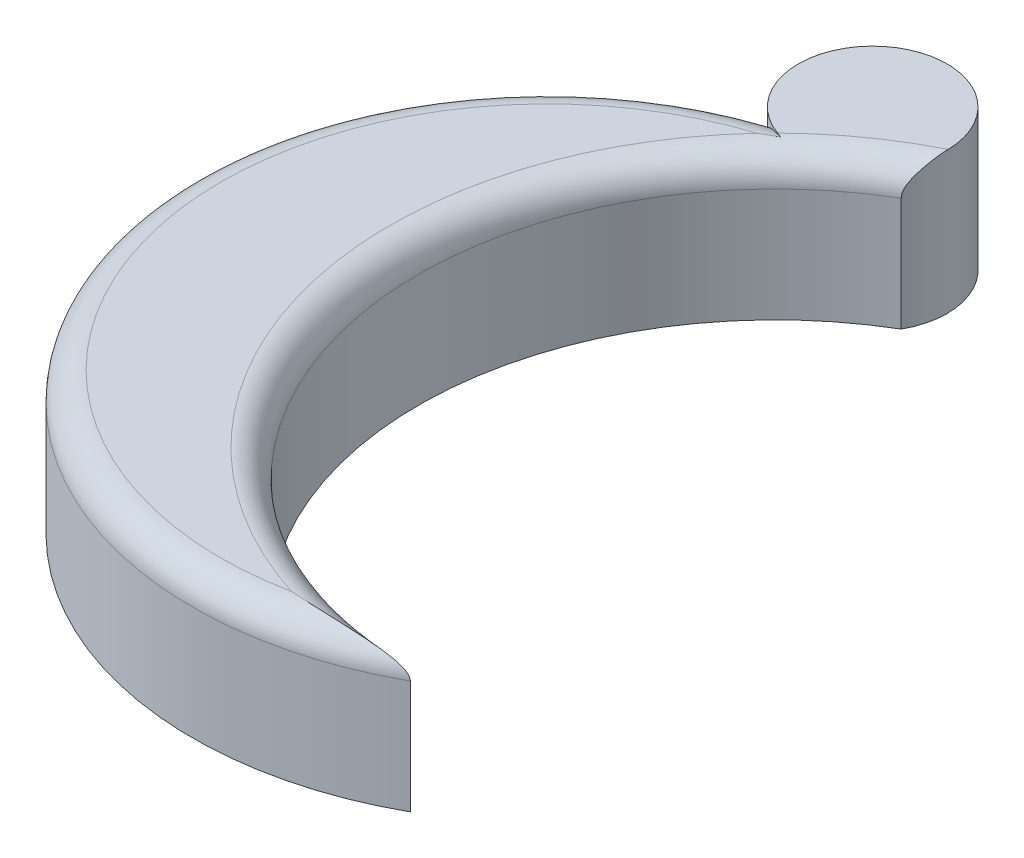
from build123d import *

# Parameters (mm, degrees)
SALIENTE_EXTRUIR1_DEPTH = 4
REDONDEO6_R             = 0.8


with BuildPart() as part:
    # Croquis1 → Saliente-Extruir1 (new body)
    with BuildSketch(Plane(origin=(0, 0, 0), x_dir=(1, 0, 0), z_dir=(0, 1, 0))):
        with BuildLine():
            ThreePointArc((-61.883639125, 14.575898233), (-67.780374095, 1.042618708), (-53.773153629, -3.61773673))
            ThreePointArc((-53.773153629, -3.61773673), (-63.274753441, 3.910149301), (-58.646815221, 15.11424029))
            ThreePointArc((-58.646815221, 15.11424029), (-60.82603012, 18.216941024), (-61.883639125, 14.575898233))
        make_face()
    extrude(amount=SALIENTE_EXTRUIR1_DEPTH)

    # Redondeo6
    # the kernel refuses this fillet: 0.8 mm, written as the material it takes off along each edge
    with BuildSketch(Plane(origin=(-53.533974817, 4, -6.444492505), x_dir=(0.17426350002173693, 0, 0.9846990568494387), z_dir=(0.9846990568494387, 0, -0.17426350002173693))) as redondeo6_piece_1:
        with BuildLine():
            CenterArc((10.065071469 + REDONDEO6_R, REDONDEO6_R), REDONDEO6_R, 180, 90)
            Line((10.065071469 + REDONDEO6_R, 0), (10.065071469, 0))
            Line((10.065071469, 0), (10.065071469, REDONDEO6_R))
        make_face()
    revolve(axis=Axis((-53.533974817, 4, -6.444492505), (0, -1, 0)), revolution_arc=170.903989059, mode=Mode.SUBTRACT)
    with BuildSketch(Plane(origin=(-58.646815221, 4, -5.11424029), x_dir=(-0.12889969509175428, 0, -0.9916576367906682), z_dir=(0.9916576367906682, 0, -0.12889969509175428))) as redondeo6_piece_2_section:
        with BuildLine():
            CenterArc((10 - REDONDEO6_R, -REDONDEO6_R), REDONDEO6_R, 0, 90)
            Line((10 - REDONDEO6_R, 0), (10, 0))
            Line((10, 0), (10, -REDONDEO6_R))
        make_face()
    redondeo6_piece_2 = revolve(axis=Axis((-58.646815221, 4, -5.11424029), (0, 1, 0)), revolution_arc=213.241351406, mode=Mode.PRIVATE)
    redondeo6_piece_2 = redondeo6_piece_2 - Plane(origin=(-60.481031052, 3.778290137, -16.142607032), x_dir=(0.8722614376655369, 0, 0.48903985968594704), z_dir=(0, -1, 0)) * Cylinder(2.102828064, 41, mode=Mode.PRIVATE)
    add(redondeo6_piece_2, mode=Mode.SUBTRACT)


solid = part.part
